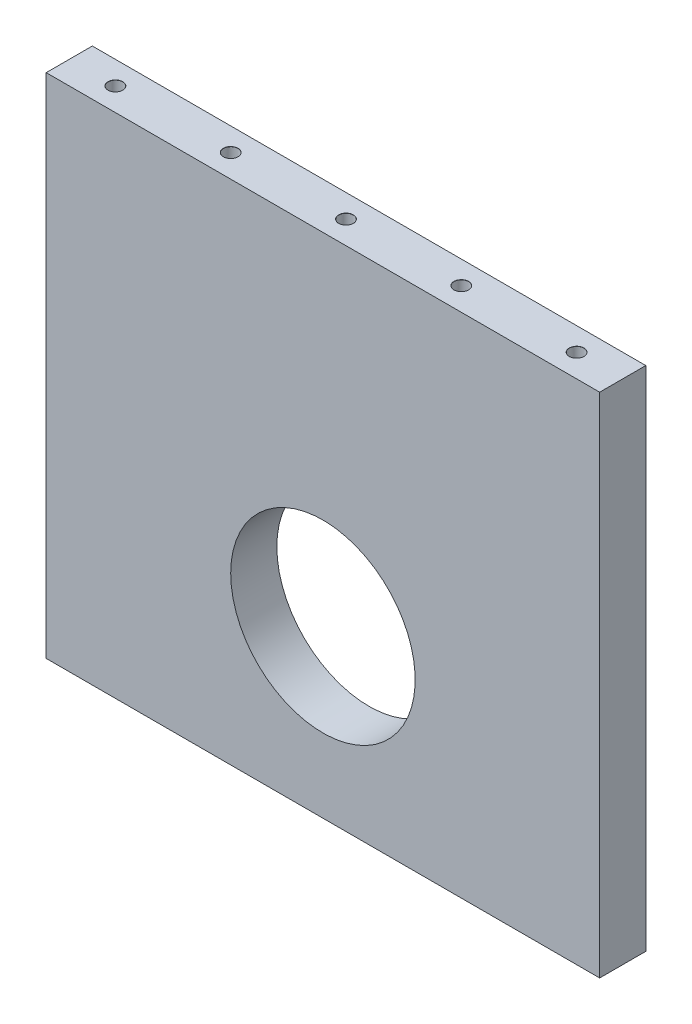
from build123d import *

# Parameters (mm, degrees)
SKETCH1_W                              = 120
SKETCH1_H                              = 110
BOSS_EXTRUDE1_DEPTH                    = 10
TAP_DRILL_FOR_M3_HELICOIL1_D           = 3.15
TAP_DRILL_FOR_M3_HELICOIL1_DEPTH       = 6
TAP_DRILL_FOR_M3_HELICOIL1_CSINK_D     = 3.2
TAP_DRILL_FOR_M3_HELICOIL1_CSINK_ANGLE = 90
TAP_DRILL_FOR_M3_HELICOIL1_TIP         = 0.946355475
F_40_0_40_DIAMETER_HOLE1_D             = 40


with BuildPart() as part:
    # Sketch1 → Boss-Extrude1 (new body)
    with BuildSketch(Plane.XY):
        with Locations((60, 55)):
            Rectangle(SKETCH1_W, SKETCH1_H)
    extrude(amount=BOSS_EXTRUDE1_DEPTH)

    # Tap Drill for M3 Helicoil1
    with Locations(Plane(origin=(0, 110, 0), x_dir=(1, 0, 0), z_dir=(0, 1, 0))):
        with Locations((10, -5), (60, -5), (85, -5), (110, -5), (35, -5)):
            CounterSinkHole(TAP_DRILL_FOR_M3_HELICOIL1_D / 2, TAP_DRILL_FOR_M3_HELICOIL1_CSINK_D / 2, depth=TAP_DRILL_FOR_M3_HELICOIL1_DEPTH, counter_sink_angle=TAP_DRILL_FOR_M3_HELICOIL1_CSINK_ANGLE)
            with Locations((0, 0, -(TAP_DRILL_FOR_M3_HELICOIL1_DEPTH + TAP_DRILL_FOR_M3_HELICOIL1_TIP / 2))):  # 118° drill point
                Cone(0, TAP_DRILL_FOR_M3_HELICOIL1_D / 2, TAP_DRILL_FOR_M3_HELICOIL1_TIP, mode=Mode.SUBTRACT)

    # Ø40.0 (40) Diameter Hole1 (through all)
    with Locations(Plane(origin=(0, 0, 0), x_dir=(-1, 0, 0), z_dir=(0, 0, -1))):
        with Locations((-60, 36)):
            Hole(F_40_0_40_DIAMETER_HOLE1_D / 2)


solid = part.part
